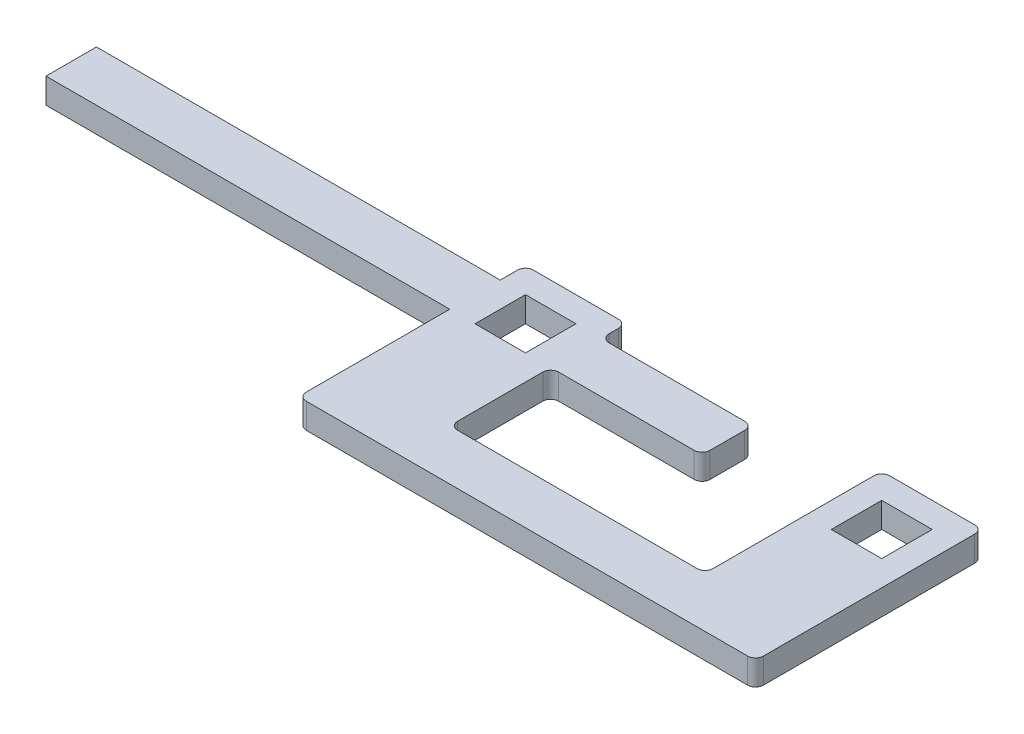
from build123d import *

# Parameters (mm, degrees)
SKETCH1_W              = 6.35
SKETCH1_H              = 6.35
ELASTIC_EXTRUDE_DEPTH  = 3.175
ELASTIC_CORNERFILLET_R = 1


with BuildPart() as part:
    # Sketch1 → Elastic_Extrude (new body)
    with BuildSketch(Plane(origin=(0, 0, 0), x_dir=(1, 0, 0), z_dir=(0, 1, 0))):
        Polygon((0, 0), (0, 19.05), (-50.8, 19.05), (-50.8, 25.4), (0, 25.4), (0, 28.575), (12.7, 28.575), (12.7, 25.4), (31.75, 25.4), (31.75, 19.05), (12.7, 19.05), (12.7, 6.35), (44.825000012, 6.35), (44.825000012, 28.575), (57.525000012, 28.575), (57.525000012, 0), (42.650000044, 0), (19.05, 0), align=None)
        with Locations((6.35, 22.225)):
            Rectangle(SKETCH1_W, SKETCH1_H, mode=Mode.SUBTRACT)
        with Locations((51.175000012, 22.225)):
            Rectangle(SKETCH1_W, SKETCH1_H, mode=Mode.SUBTRACT)
    extrude(amount=ELASTIC_EXTRUDE_DEPTH)

    # Elastic_CornerFillet
    elastic_cornerfillet_edges = [part.edges().sort_by_distance(p)[0] for p in [
        (12.7, 1.5875, -6.35),
        (44.825000012, 1.5875, -6.35),
        (44.825000012, 1.5875, -28.575),
        (57.525000012, 1.5875, -28.575),
        (57.525000012, 1.5875, 0),
        (0, 1.5875, 0),
        (0, 1.5875, -28.575),
        (12.7, 1.5875, -19.05),
        (31.75, 1.5875, -19.05),
        (31.75, 1.5875, -25.4),
        (12.7, 1.5875, -25.4),
        (12.7, 1.5875, -28.575),
    ]]
    fillet(elastic_cornerfillet_edges, radius=ELASTIC_CORNERFILLET_R)


solid = part.part
